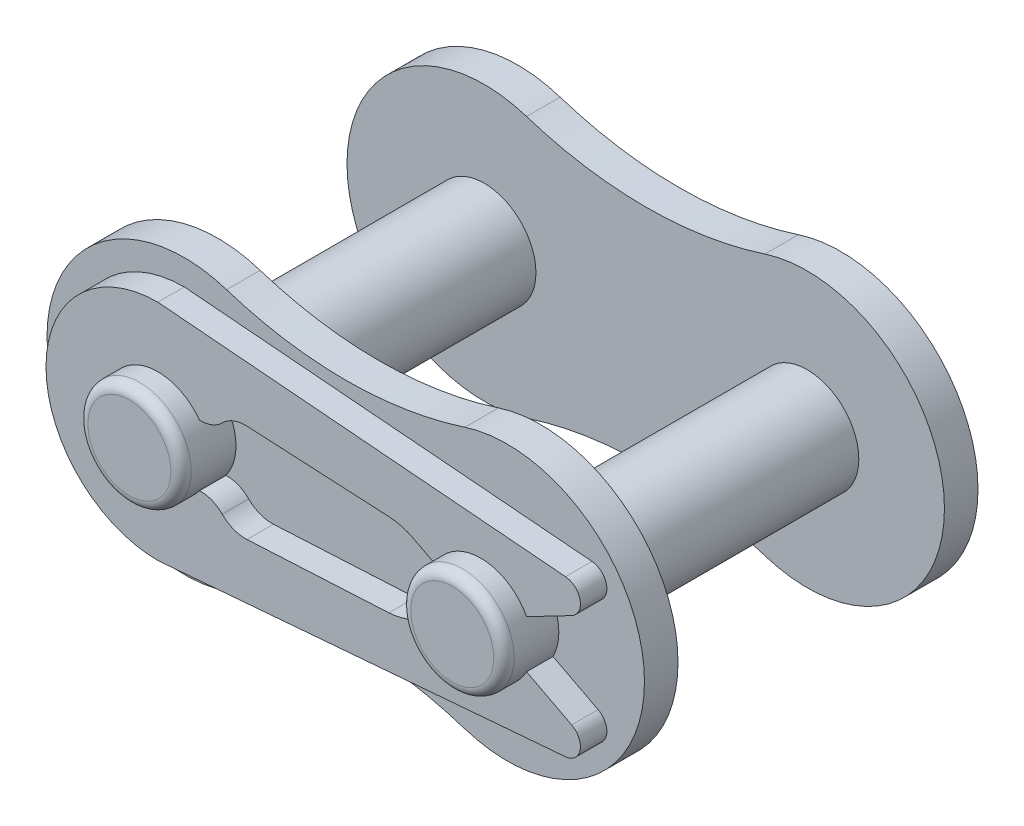
from build123d import *

# Parameters (mm, degrees)
BOSS_EXTRUDE1_START = 1.65
SKETCH3_R           = 2.54
BOSS_EXTRUDE1_DEPTH = 1.65
BOSS_EXTRUDE2_START = 1.3
BOSS_EXTRUDE2_DEPTH = 1.3


with BuildPart() as part:
    # Sketch1 → Revolve1 (revolve)
    with BuildSketch(Plane(origin=(0, 0, 0), x_dir=(1, 0, 0), z_dir=(0, 1, 0))):
        with BuildLine():
            Line((0, -10.9), (0, 9.6))
            ThreePointArc((0, 9.6), (2.166217902, 9.240352428), (4.1, 8.2))
            Line((4.1, 8.2), (2.54, 8.2))
            Line((2.54, 8.2), (2.54, -10.4))
            ThreePointArc((2.54, -10.4), (2.393553391, -10.753553391), (2.04, -10.9))
            Line((2.04, -10.9), (0, -10.9))
        make_face()
    revolve(axis=Axis((0, 0, -10.625), (0, 0, 1)))



with BuildPart() as body_2:
    # Sketch2 → Revolve2 (revolve)
    with BuildSketch(Plane.XZ):
        with BuildLine():
            Line((-15.875, 10.9), (-17.915, 10.9))
            ThreePointArc((-17.915, 10.9), (-18.268553391, 10.753553391), (-18.415, 10.4))
            Line((-18.415, 10.4), (-18.415, -8.2))
            Line((-18.415, -8.2), (-19.975, -8.2))
            ThreePointArc((-19.975, -8.2), (-18.041217902, -9.240352428), (-15.875, -9.6))
            Line((-15.875, -9.6), (-15.875, 10.9))
        make_face()
    revolve(axis=Axis((-15.875, 0, 10.9), (0, 0, -1)))


with BuildPart() as part_1:
    add(part.part)

    add(body_2.part)  # Boss-Extrude1 merges body 2
    # Sketch3 → Boss-Extrude1 (add)
    with BuildSketch(Plane(origin=(0, 0, -8.2), x_dir=(0, 1, 0), z_dir=(0, 0, 1)).offset(BOSS_EXTRUDE1_START)):
        with BuildLine():
            ThreePointArc((-6.421306047, 2.080703883), (0, -6.75), (6.421306047, 2.080703883))
            ThreePointArc((6.421306047, 2.080703883), (5.496093439, 7.9375), (6.421306047, 13.794296117))
            ThreePointArc((6.421306047, 13.794296117), (0, 22.625), (-6.421306047, 13.794296117))
            ThreePointArc((-6.421306047, 13.794296117), (-5.496093439, 7.9375), (-6.421306047, 2.080703883))
        make_face()
        Circle(SKETCH3_R, mode=Mode.SUBTRACT)
        with Locations((0, 15.875)):
            Circle(SKETCH3_R, mode=Mode.SUBTRACT)
    boss_extrude1 = extrude(amount=-BOSS_EXTRUDE1_DEPTH)

    # Mirror1: Boss-Extrude1 across plane
    add(boss_extrude1.mirror(Plane.XY))

    # Sketch4 → Boss-Extrude2 (add)
    with BuildSketch(Plane.XY.offset(8.2).offset(BOSS_EXTRUDE2_START)):
        with BuildLine():
            Line((4.168264195, 3.834533178), (-15.875, 5.5))
            ThreePointArc((-15.875, 5.5), (-21.375, 0), (-15.875, -5.5))
            Line((-15.875, -5.5), (4.168264195, -3.834533178))
            ThreePointArc((4.168264195, -3.834533178), (4.886303489, -3.195064454), (4.471416519, -2.327672109))
            Line((4.471416519, -2.327672109), (2.253007516, -1.172841478))
            ThreePointArc((2.253007516, -1.172841478), (0, -2.54), (-2.253007516, -1.172841478))
            Line((-2.253007516, -1.172841478), (-3.291734151, -1.713568338))
            ThreePointArc((-3.291734151, -1.713568338), (-3.887886347, -1.94689781), (-4.519972122, -2.048424443))
            Line((-4.519972122, -2.048424443), (-11.49126247, -2.413774289))
            ThreePointArc((-11.49126247, -2.413774289), (-12.151107901, -2.308649078), (-12.710483871, -1.943209855))
            ThreePointArc((-12.710483871, -1.943209855), (-13.222010624, -1.605653289), (-13.825850734, -1.50086218))
            ThreePointArc((-13.825850734, -1.50086218), (-18.415, 0), (-13.825850734, 1.50086218))
            ThreePointArc((-13.825850734, 1.50086218), (-13.222010624, 1.605653289), (-12.710483871, 1.943209855))
            ThreePointArc((-12.710483871, 1.943209855), (-12.151107901, 2.308649078), (-11.49126247, 2.413774289))
            Line((-11.49126247, 2.413774289), (-4.519972122, 2.048424443))
            ThreePointArc((-4.519972122, 2.048424443), (-3.887886347, 1.94689781), (-3.291734151, 1.713568338))
            Line((-3.291734151, 1.713568338), (-2.253007516, 1.172841478))
            ThreePointArc((-2.253007516, 1.172841478), (0, 2.54), (2.253007516, 1.172841478))
            Line((2.253007516, 1.172841478), (4.471416519, 2.327672109))
            ThreePointArc((4.471416519, 2.327672109), (4.886303489, 3.195064454), (4.168264195, 3.834533178))
        make_face()
    extrude(amount=-BOSS_EXTRUDE2_DEPTH)


solid = part_1.part
